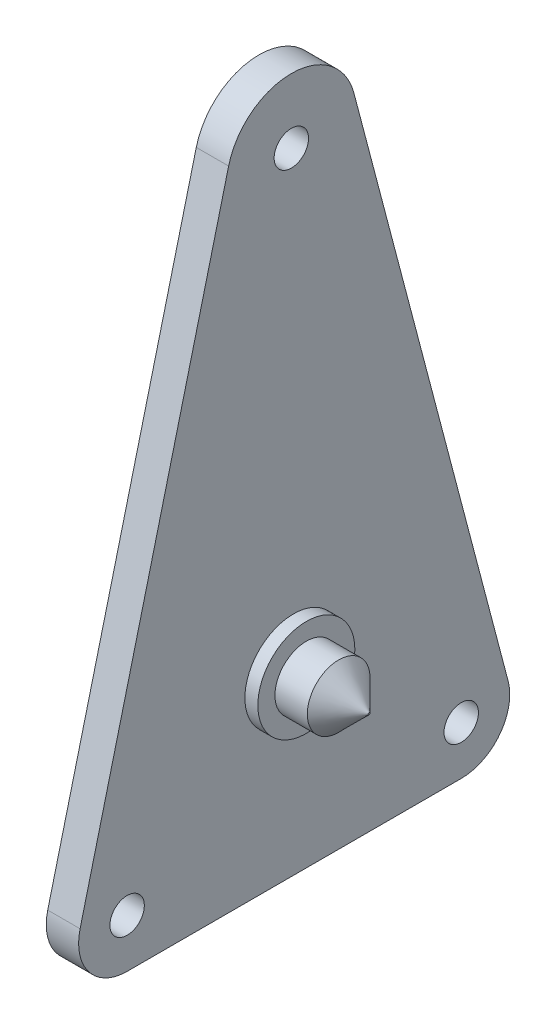
from build123d import *

# Parameters (mm, degrees)
BOSS_EXTRUDE1_DEPTH     = 6.35
SKETCH6_R               = 9.525
BOSS_EXTRUDE4_DEPTH     = 2.54
SKETCH5_R               = 6.1595
BOSS_EXTRUDE3_DEPTH     = 12.319
CHAMFER1_SIZE           = 5.969
F_1_4_CLEARANCE_HOLE1_D = 6.7564


with BuildPart() as part:
    # Sketch1 → Boss-Extrude1 (new body)
    with BuildSketch(Plane(origin=(0, 0, 0), x_dir=(0, 0, -1), z_dir=(1, 0, 0))):
        with BuildLine():
            Line((-12.714021219, 92.018306138), (-33.85522178, 8.577854234))
            Line((-33.85522178, 8.577854234), (-41.871412709, -23.060585209))
            ThreePointArc((-41.871412709, -23.060585209), (-40.155102987, -31.249901671), (-32.638170405, -34.925))
            Line((-32.638170405, -34.925), (32.945246218, -34.925))
            ThreePointArc((32.945246218, -34.925), (40.4886223, -31.215763258), (42.156897549, -22.976963733))
            Line((42.156897549, -22.976963733), (33.776054881, 8.884466312))
            Line((33.776054881, 8.884466312), (11.879170294, 92.129801439))
            ThreePointArc((11.879170294, 92.129801439), (-0.460607407, 101.598955904), (-12.714021219, 92.018306138))
        make_face()
    extrude(amount=BOSS_EXTRUDE1_DEPTH)

    # Sketch6 → Boss-Extrude4 (add)
    with BuildSketch(Plane(origin=(6.35, 0, 0), x_dir=(0, 0, -1), z_dir=(1, 0, 0))):
        Circle(SKETCH6_R)
    extrude(amount=BOSS_EXTRUDE4_DEPTH)

    # Sketch5 → Boss-Extrude3 (add)
    with BuildSketch(Plane(origin=(8.89, 0, 0), x_dir=(0, 0, -1), z_dir=(1, 0, 0))):
        Circle(SKETCH5_R)
    extrude(amount=BOSS_EXTRUDE3_DEPTH)

    # Chamfer1
    chamfer1_edges = [part.edges().sort_by_distance(p)[0] for p in [
        (21.209, 0, 6.1595),
    ]]
    chamfer(chamfer1_edges, length=CHAMFER1_SIZE)

    # 1/4 Clearance Hole1 (through all)
    with Locations(Plane(origin=(6.35, 0, 0), x_dir=(0, 0, -1), z_dir=(1, 0, 0))):
        with Locations((-0.403031481, 88.899086416), (32.945246218, -25.4), (-32.638170405, -25.4)):
            Hole(F_1_4_CLEARANCE_HOLE1_D / 2)


solid = part.part
